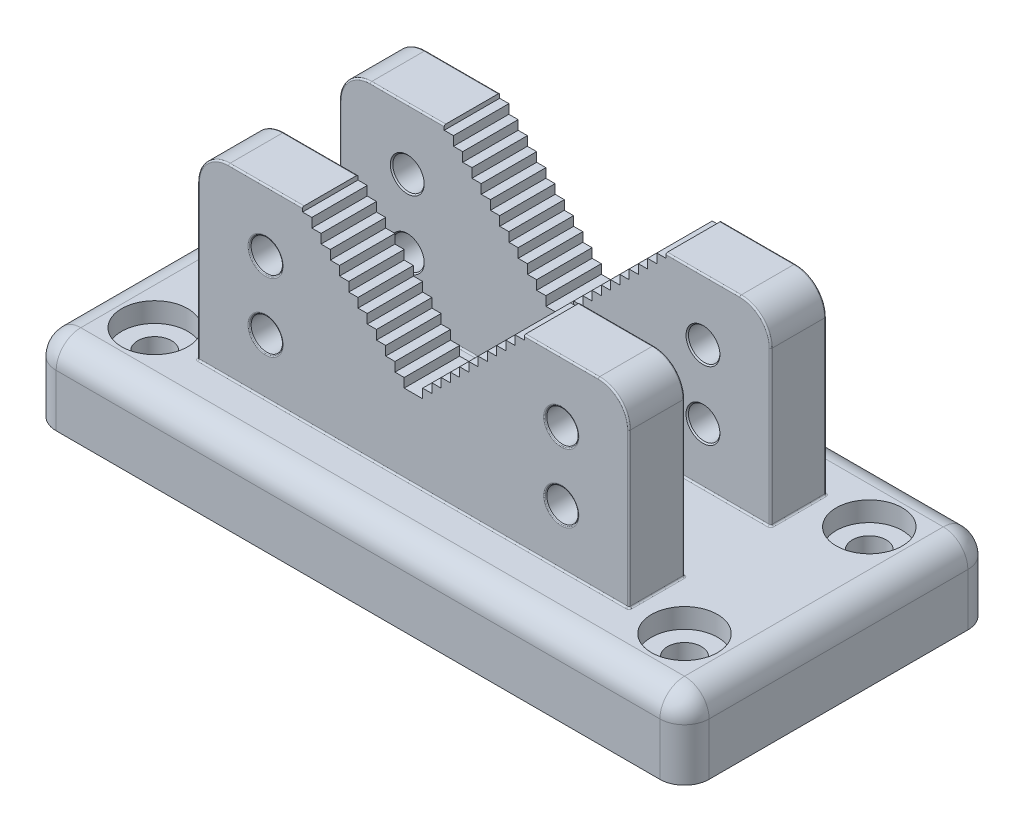
from build123d import *

# Parameters (mm, degrees)
BOSS_EXTRUDE1_DEPTH                      = 50
BOSS_EXTRUDE2_START                      = 14
SKETCH1_3_R                              = 5
BOSS_EXTRUDE2_DEPTH                      = 18
BOSS_EXTRUDE3_START                      = -32
SKETCH1_4_R                              = 5
BOSS_EXTRUDE3_DEPTH                      = 18
FILLET1_R                                = 8
FILLET2_R                                = 8
FILLET3_R                                = 8
CHAMFER1_SIZE                            = 0.5
FILLET4_R                                = 0.5
CUT_EXTRUDE4_DEPTH                       = 70
CBORE_FOR_M10_HEX_HEAD_BOLT1_D           = 11
CBORE_FOR_M10_HEX_HEAD_BOLT1_CBORE_D     = 21.475
CBORE_FOR_M10_HEX_HEAD_BOLT1_CBORE_DEPTH = 6.4
F_10_2_10_2_DIAMETER_HOLE1_D             = 10.2


with BuildPart() as part:
    # Sketch1 → Boss-Extrude1 (new, symmetric)
    with BuildSketch(Plane.XY):
        Polygon((-106, 0), (0, 0), (0, 25), (-70, 25), (-106, 25), align=None)
        Polygon((0, 25), (0, 0), (106, 0), (106, 25), (70, 25), align=None)
    extrude(amount=BOSS_EXTRUDE1_DEPTH, both=True)

    # Sketch1<3> → Boss-Extrude2 (add)
    with BuildSketch(Plane.XY.offset(BOSS_EXTRUDE2_START)):
        with BuildLine():
            Line((-70, 75), (-70, 25))
            Line((-70, 25), (70, 25))
            Line((70, 25), (70, 75))
            ThreePointArc((70, 75), (67.071067812, 82.071067812), (60, 85))
            Line((60, 85), (34, 85))
            Line((34, 85), (7.071067812, 58.071067812))
            ThreePointArc((7.071067812, 58.071067812), (0, 55.142135624), (-7.071067812, 58.071067812))
            Line((-7.071067812, 58.071067812), (-34, 85))
            Line((-34, 85), (-60, 85))
            ThreePointArc((-60, 85), (-67.071067812, 82.071067812), (-70, 75))
        make_face()
        with Locations((-48, 43)):
            Circle(SKETCH1_3_R, mode=Mode.SUBTRACT)
        with Locations((-48, 65.142135624)):
            Circle(SKETCH1_3_R, mode=Mode.SUBTRACT)
        with Locations((48, 43)):
            Circle(SKETCH1_3_R, mode=Mode.SUBTRACT)
        with Locations((48, 65.142135624)):
            Circle(SKETCH1_3_R, mode=Mode.SUBTRACT)
    extrude(amount=BOSS_EXTRUDE2_DEPTH)

    # Sketch1<4> → Boss-Extrude3 (add)
    with BuildSketch(Plane.XY.offset(BOSS_EXTRUDE3_START)):
        with BuildLine():
            Line((-70, 75), (-70, 25))
            Line((-70, 25), (70, 25))
            Line((70, 25), (70, 75))
            ThreePointArc((70, 75), (67.071067812, 82.071067812), (60, 85))
            Line((60, 85), (34, 85))
            Line((34, 85), (7.071067812, 58.071067812))
            ThreePointArc((7.071067812, 58.071067812), (0, 55.142135624), (-7.071067812, 58.071067812))
            Line((-7.071067812, 58.071067812), (-34, 85))
            Line((-34, 85), (-60, 85))
            ThreePointArc((-60, 85), (-67.071067812, 82.071067812), (-70, 75))
        make_face()
        with Locations((-48, 43)):
            Circle(SKETCH1_4_R, mode=Mode.SUBTRACT)
        with Locations((-48, 65.142135624)):
            Circle(SKETCH1_4_R, mode=Mode.SUBTRACT)
        with Locations((48, 43)):
            Circle(SKETCH1_4_R, mode=Mode.SUBTRACT)
        with Locations((48, 65.142135624)):
            Circle(SKETCH1_4_R, mode=Mode.SUBTRACT)
    extrude(amount=BOSS_EXTRUDE3_DEPTH)

    # Fillet1
    fillet1_edges = [part.edges().sort_by_distance(p)[0] for p in [
        (0, 25, 50),
        (0, 25, -50),
        (-106, 25, 0),
        (106, 25, 0),
    ]]
    fillet(fillet1_edges, radius=FILLET1_R)

    # Fillet2
    # the kernel refuses this fillet: 8 mm, written as the material it takes off along each edge
    with BuildSketch(Plane(origin=(98, 17, 42), x_dir=(0, 0, 1), z_dir=(1, 0, 0))) as fillet2_piece_1_section:
        Polygon((0, 0), (FILLET2_R, 0), (FILLET2_R, -FILLET2_R), (0, -FILLET2_R), align=None)
    fillet2_piece_1 = extrude(amount=FILLET2_R, mode=Mode.PRIVATE)
    fillet2_piece_1 = fillet2_piece_1 - Plane(origin=(98, 17, 42), x_dir=(0, -0.7071067811865475, -0.7071067811865475), z_dir=(1, 0, 0)) * Sphere(FILLET2_R, mode=Mode.PRIVATE)
    add(fillet2_piece_1, mode=Mode.SUBTRACT)
    with BuildSketch(Plane(origin=(98, 17, -42), x_dir=(1, 0, 0), z_dir=(0, 0, -1))) as fillet2_piece_2_section:
        Polygon((0, 0), (FILLET2_R, 0), (FILLET2_R, -FILLET2_R), (0, -FILLET2_R), align=None)
    fillet2_piece_2 = extrude(amount=FILLET2_R, mode=Mode.PRIVATE)
    fillet2_piece_2 = fillet2_piece_2 - Plane(origin=(98, 17, -42), x_dir=(-0.7071067811865475, -0.7071067811865475, 0), z_dir=(0, 0, -1)) * Sphere(FILLET2_R, mode=Mode.PRIVATE)
    add(fillet2_piece_2, mode=Mode.SUBTRACT)
    with BuildSketch(Plane(origin=(106, -20, -50), x_dir=(-1, 0, 0), z_dir=(0, 1, 0)), Plane(origin=(106, -20, 50), x_dir=(0, 0, -1), z_dir=(0, 1, 0))) as fillet2_piece_3:
        with BuildLine():
            CenterArc((FILLET2_R, FILLET2_R), FILLET2_R, 180, 90)
            Line((0, FILLET2_R), (0, 0))
            Line((0, 0), (FILLET2_R, 0))
        make_face()
    extrude(amount=37, mode=Mode.SUBTRACT)

    # Fillet3
    # the kernel refuses this fillet: 8 mm, written as the material it takes off along each edge
    with BuildSketch(Plane(origin=(-98, 17, 42), x_dir=(0, 0, 1), z_dir=(-1, 0, 0))) as fillet3_piece_1_section:
        Polygon((0, 0), (FILLET3_R, 0), (FILLET3_R, FILLET3_R), (0, FILLET3_R), align=None)
    fillet3_piece_1 = extrude(amount=FILLET3_R, mode=Mode.PRIVATE)
    fillet3_piece_1 = fillet3_piece_1 - Plane(origin=(-98, 17, 42), x_dir=(0, -0.7071067811865475, -0.7071067811865475), z_dir=(-1, 0, 0)) * Sphere(FILLET3_R, mode=Mode.PRIVATE)
    add(fillet3_piece_1, mode=Mode.SUBTRACT)
    with BuildSketch(Plane(origin=(-98, 17, -42), x_dir=(-1, 0, 0), z_dir=(0, 0, -1))) as fillet3_piece_2_section:
        Polygon((0, 0), (FILLET3_R, 0), (FILLET3_R, FILLET3_R), (0, FILLET3_R), align=None)
    fillet3_piece_2 = extrude(amount=FILLET3_R, mode=Mode.PRIVATE)
    fillet3_piece_2 = fillet3_piece_2 - Plane(origin=(-98, 17, -42), x_dir=(0.7071067811865475, -0.7071067811865475, 0), z_dir=(0, 0, -1)) * Sphere(FILLET3_R, mode=Mode.PRIVATE)
    add(fillet3_piece_2, mode=Mode.SUBTRACT)
    with BuildSketch(Plane(origin=(-106, 17, -50), x_dir=(1, 0, 0), z_dir=(0, -1, 0)), Plane(origin=(-106, 17, 50), x_dir=(0, 0, -1), z_dir=(0, -1, 0))) as fillet3_piece_3:
        with BuildLine():
            CenterArc((FILLET3_R, FILLET3_R), FILLET3_R, 180, 90)
            Line((0, FILLET3_R), (0, 0))
            Line((0, 0), (FILLET3_R, 0))
        make_face()
    extrude(amount=37, mode=Mode.SUBTRACT)

    # Chamfer1
    chamfer1_edges = [part.edges().sort_by_distance(p)[0] for p in [
        (43, 43, 32),
        (43, 65.142135624, 32),
        (-53, 65.142135624, 14),
        (-53, 43, 14),
        (-53, 65.142135624, 32),
        (-53, 43, 32),
        (43, 65.142135624, 14),
        (43, 43, 14),
        (43, 43, -14),
        (43, 65.142135624, -14),
        (-53, 65.142135624, -32),
        (-53, 43, -32),
        (43, 65.142135624, -32),
        (43, 43, -32),
        (-53, 65.142135624, -14),
        (-53, 43, -14),
    ]]
    chamfer(chamfer1_edges, length=CHAMFER1_SIZE)

    # Fillet4
    fillet4_edges = [part.edges().sort_by_distance(p)[0] for p in [
        (42.5, 65.142135624, 32),
        (42.5, 43, 32),
        (-67.071067812, 82.071067812, 32),
        (-53.5, 43, 32),
        (-53.5, 65.142135624, 32),
        (-70, 50, 32),
        (0, 25, 14),
        (42.5, 43, -32),
        (42.5, 65.142135624, -32),
        (-70, 25, 23),
        (-53.5, 43, -32),
        (70, 50, 14),
        (-53.5, 65.142135624, -32),
        (-53, 43, -31.5),
        (70, 25, 23),
        (67.071067812, 82.071067812, 14),
        (47, 85, 14),
        (20.535533906, 71.535533906, 14),
        (34, 85, 23),
        (0, 55.142135624, 32),
        (-20.535533906, 71.535533906, 32),
        (-47, 85, 32),
        (-34, 85, 23),
        (0, 25, 32),
        (70, 50, 32),
        (67.071067812, 82.071067812, 32),
        (47, 85, 32),
        (20.535533906, 71.535533906, 32),
        (-67.071067812, 82.071067812, 14),
        (-47, 85, 14),
        (-20.535533906, 71.535533906, 14),
        (0, 55.142135624, 14),
        (-70, 50, 14),
        (-67.071067812, 82.071067812, -14),
        (-47, 85, -14),
        (-20.535533906, 71.535533906, -14),
        (-34, 85, -23),
        (0, 55.142135624, -14),
        (20.535533906, 71.535533906, -32),
        (47, 85, -32),
        (34, 85, -23),
        (67.071067812, 82.071067812, -32),
        (70, 50, -32),
        (0, 25, -32),
        (70, 25, -23),
        (-70, 50, -14),
        (-70, 25, -23),
        (-67.071067812, 82.071067812, -32),
        (-47, 85, -32),
        (-20.535533906, 71.535533906, -32),
        (0, 55.142135624, -32),
        (-70, 50, -32),
        (0, 25, -14),
        (70, 50, -14),
        (67.071067812, 82.071067812, -14),
        (47, 85, -14),
        (20.535533906, 71.535533906, -14),
    ]]
    fillet(fillet4_edges, radius=FILLET4_R)

    # Sketch2 → Cut-Extrude4 (cut)
    with BuildSketch(Plane.XY.offset(32)):
        Polygon((-3, 50.5), (3, 50.5), (3, 53.5), (6, 53.5), (6, 56.5), (9, 56.5), (9, 59.5), (12, 59.5), (12, 62.5), (15, 62.5), (15, 65.5), (18, 65.5), (18, 68.5), (21, 68.5), (21, 71.5), (24, 71.5), (24, 74.5), (27, 74.5), (27, 77.5), (30, 77.5), (30, 80.5), (33, 80.5), (33, 83.5), (36, 83.5), (36, 86.5), (-36, 86.5), (-36, 83.5), (-33, 83.5), (-33, 80.5), (-30, 80.5), (-30, 77.5), (-27, 77.5), (-27, 74.5), (-24, 74.5), (-24, 71.5), (-21, 71.5), (-21, 68.5), (-18, 68.5), (-18, 65.5), (-15, 65.5), (-15, 62.5), (-12, 62.5), (-12, 59.5), (-9, 59.5), (-9, 56.5), (-6, 56.5), (-6, 53.5), (-3, 53.5), align=None)
    extrude(amount=-CUT_EXTRUDE4_DEPTH, mode=Mode.SUBTRACT)

    # CBORE for M10 Hex Head Bolt1 (through all)
    with Locations(Plane(origin=(0, 25, 0), x_dir=(1, 0, 0), z_dir=(0, 1, 0))):
        with Locations((-86, 30), (86, 30), (86, -30), (-86, -30)):
            CounterBoreHole(CBORE_FOR_M10_HEX_HEAD_BOLT1_D / 2, CBORE_FOR_M10_HEX_HEAD_BOLT1_CBORE_D / 2, CBORE_FOR_M10_HEX_HEAD_BOLT1_CBORE_DEPTH)

    # Ø10.2 (10.2) Diameter Hole1 (through all)
    with Locations(Plane.XY.offset(32)):
        with Locations((48, 65.142135624), (-48, 65.142135624), (-48, 43), (48, 43)):
            Hole(F_10_2_10_2_DIAMETER_HOLE1_D / 2)


solid = part.part
